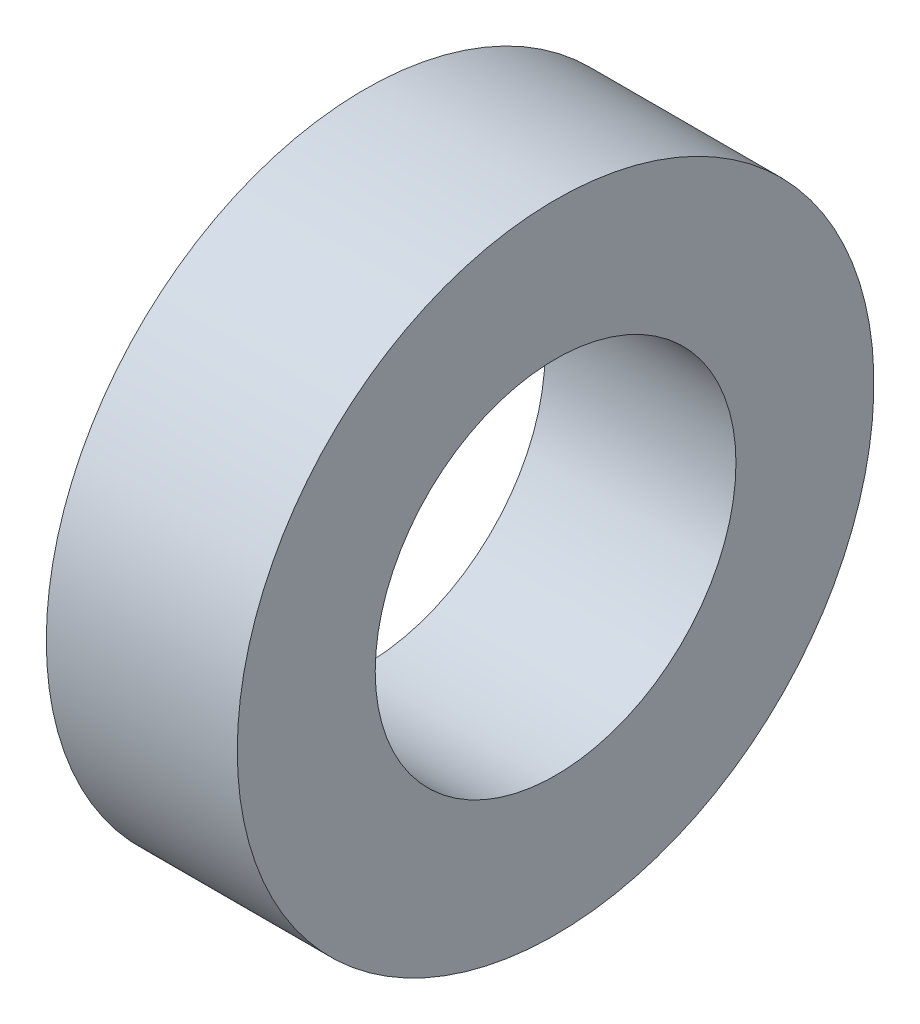
from build123d import *

# Parameters (mm, degrees)
SZKIC1_W = 9
SZKIC1_H = 6.5


with BuildPart() as part:
    # Szkic1 → Obrót1 (revolve)
    with BuildSketch(Plane.XY):
        with Locations((4.5, 11.75)):
            Rectangle(SZKIC1_W, SZKIC1_H)
    revolve(axis=Axis((0, 0, 0), (1, 0, 0)))


solid = part.part
